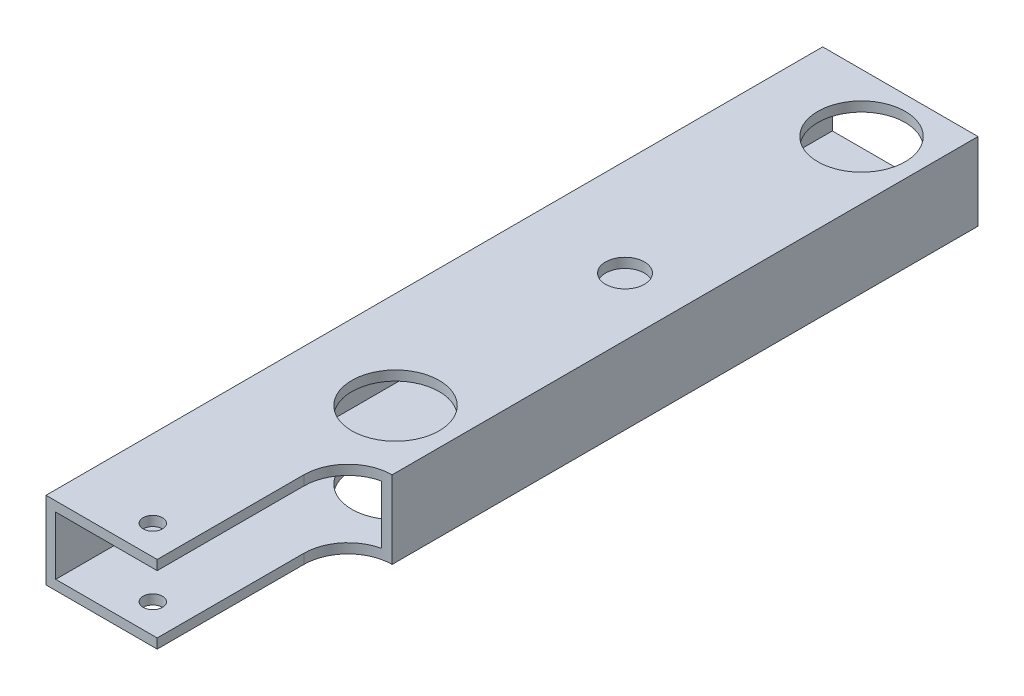
from build123d import *

# Parameters (mm, degrees)
SKETCH1_W           = 50.8
SKETCH1_H           = 25.4
SKETCH1_W_2         = 44.45
SKETCH1_H_2         = 19.05
BOSS_EXTRUDE1_DEPTH = 254
SKETCH2_R           = 14.2875
CUT_EXTRUDE1_DEPTH  = 261.272549455
SKETCH3_R           = 3.175
CUT_EXTRUDE2_DEPTH  = 261.272549455
CUT_EXTRUDE3_DEPTH  = 261.272549455
SKETCH5_R           = 2.667
CUT_EXTRUDE4_DEPTH  = 261.272549455
CUT_EXTRUDE5_REACH  = 262.273
SKETCH6_R           = 6.35


with BuildPart() as part:
    # Sketch1 → Boss-Extrude1 (new body)
    with BuildSketch(Plane.XY):
        with Locations((25.4, 12.7)):
            Rectangle(SKETCH1_W, SKETCH1_H)
        with Locations((25.4, 12.7)):
            Rectangle(SKETCH1_W_2, SKETCH1_H_2, mode=Mode.SUBTRACT)
    extrude(amount=BOSS_EXTRUDE1_DEPTH)

    # Sketch2 → Cut-Extrude1 (cut, through all)
    with BuildSketch(Plane(origin=(0, 25.4, 0), x_dir=(1, 0, 0), z_dir=(0, 1, 0))):
        with Locations((31.75, -19.05)):
            Circle(SKETCH2_R)
        with Locations((31.75, -171.45)):
            Circle(SKETCH2_R)
    extrude(amount=-CUT_EXTRUDE1_DEPTH, mode=Mode.SUBTRACT)

    # Sketch3 → Cut-Extrude2 (cut, through all)
    with BuildSketch(Plane(origin=(0, 25.4, 0), x_dir=(1, 0, 0), z_dir=(0, 1, 0))):
        with Locations((25.4, -244.475)):
            Circle(SKETCH3_R)
    extrude(amount=-CUT_EXTRUDE2_DEPTH, mode=Mode.SUBTRACT)

    # Sketch4 → Cut-Extrude3 (cut, through all)
    with BuildSketch(Plane(origin=(0, 25.4, 0), x_dir=(1, 0, 0), z_dir=(0, 1, 0))):
        with BuildLine():
            Line((36.358855328, -254), (36.358855328, -206.035443665))
            ThreePointArc((36.358855328, -206.035443665), (40.588568674, -195.824012339), (50.8, -191.594298992))
            Line((50.8, -191.594298992), (50.8, -254))
            Line((50.8, -254), (36.358855328, -254))
        make_face()
    extrude(amount=-CUT_EXTRUDE3_DEPTH, mode=Mode.SUBTRACT)

    # Sketch5 → Cut-Extrude4 (cut, through all)
    with BuildSketch(Plane.XZ):
        with Locations((31.75, 95.25)):
            Circle(SKETCH5_R)
    extrude(amount=-CUT_EXTRUDE4_DEPTH, mode=Mode.SUBTRACT)

    # Sketch6 → Cut-Extrude5 (cut, up to next)
    with BuildSketch(Plane(origin=(0, 25.4, 0), x_dir=(1, 0, 0), z_dir=(0, 1, 0)), mode=Mode.PRIVATE) as cut_extrude5_sk1:
        with Locations((31.75, -96.395770561)):
            Circle(SKETCH6_R)
    cut_extrude5_tool1 = extrude(cut_extrude5_sk1.sketch, amount=-CUT_EXTRUDE5_REACH, mode=Mode.PRIVATE) & part.part
    add(cut_extrude5_tool1.solids().sort_by_distance((31.75, 25.4, 96.395771))[0], mode=Mode.SUBTRACT)


solid = part.part
